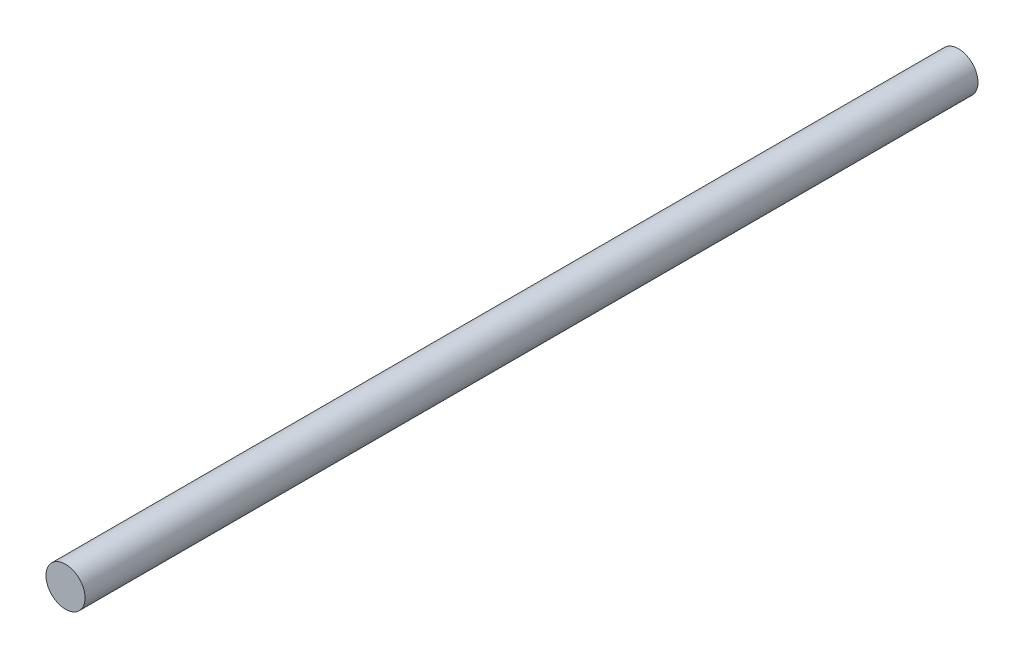
from build123d import *

# Parameters (mm, degrees)
SKETCH_1_R      = 3
EXTRUDE_1_DEPTH = 137


with BuildPart() as part:
    # 草图1 → 凸台-拉伸1 (new body)
    with BuildSketch(Plane.XY):
        Circle(SKETCH_1_R)
    extrude(amount=EXTRUDE_1_DEPTH)


solid = part.part
